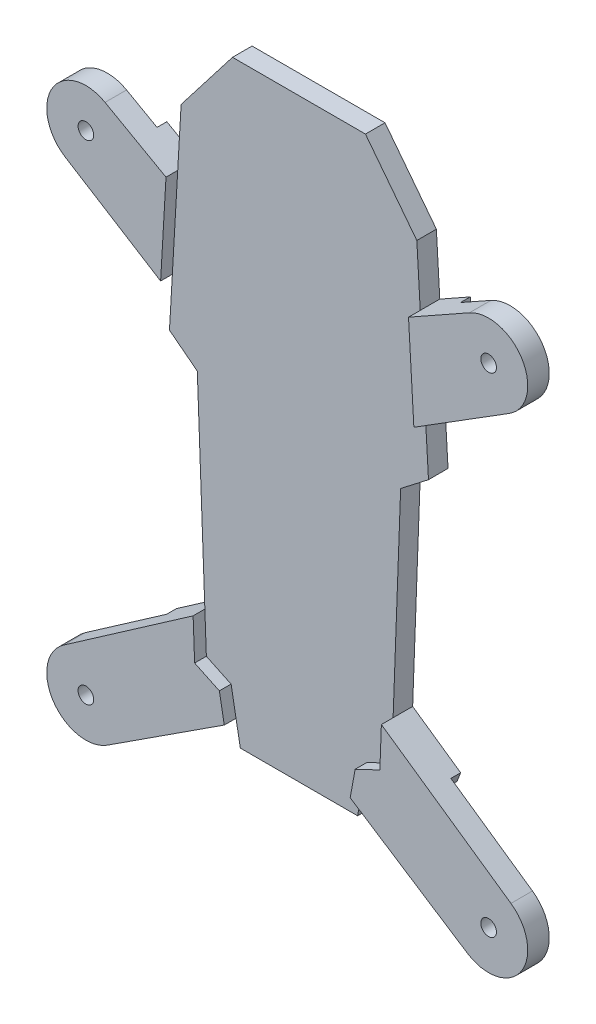
from build123d import *

# Parameters (mm, degrees)
EXTRUDE_1_DEPTH     = 5
SKETCH_2_R          = 10
SKETCH_2_R_2        = 2
EXTRUDE_2_DEPTH     = 8
SHELL_1_OUTLINE_R   = 4.5
SHELL_1_DEPTH       = 2.5
SHELL_START         = 2.5
SHELL_1_2_OUTLINE_R = 4.5
SHELL_1_2_DEPTH     = 3
CUT_EXTRUDE_6_DEPTH = 2.5


with BuildPart() as part:
    # ｽｹｯﾁ1 → ﾎﾞｽ - 押し出し1 (new body)
    with BuildSketch(Plane.XY):
        Polygon((-15, -77.5), (15, -77.5), (17.362836016, -64.5), (23.688654544, -61.502664525), (26, 0.497335475), (33.120827994, 6.001316642), (30.14, 57.5), (17, 74.5), (-17, 74.5), (-30.14, 57.5), (-33.120827994, 6.001316642), (-26, 0.497335475), (-23.688654544, -61.502664525), (-17.362836016, -64.5), align=None)
    extrude(amount=EXTRUDE_1_DEPTH)

    # ｽｹｯﾁ2 → ﾎﾞｽ - 押し出し2 (add)
    # profile 1 of 8: a face of its own
    with BuildSketch(Plane(origin=(0, 0, 0), x_dir=(-1, 0, 0), z_dir=(0, 0, -1))):
        with BuildLine():
            Line((-32.382872215, 18.750710787), (-31.011292455, 42.446996487))
            Line((-31.011292455, 42.446996487), (-46.596716305, 51.215377732))
            ThreePointArc((-46.596716305, 51.215377732), (-42.867710705, 47.548126536), (-41.5, 42.5))
            ThreePointArc((-41.5, 42.5), (-46.653423142, 33.752960915), (-56.802138552, 34.021360559))
            Line((-56.802138552, 34.021360559), (-32.382872215, 18.750710787))
        make_face()
    # profile 2 of 8: a face of its own
    with BuildSketch(Plane(origin=(0, 0, 0), x_dir=(-1, 0, 0), z_dir=(0, 0, -1))):
        with Locations((-51.5, 42.5)):
            Circle(SKETCH_2_R)
        with Locations((-51.5, 42.5)):
            Circle(SKETCH_2_R_2, mode=Mode.SUBTRACT)
    # profile 3 of 8: a face of its own
    with BuildSketch(Plane(origin=(0, 0, 0), x_dir=(-1, 0, 0), z_dir=(0, 0, -1))):
        with Locations((51.5, 42.5)):
            Circle(SKETCH_2_R)
        with Locations((51.5, 42.5)):
            Circle(SKETCH_2_R_2, mode=Mode.SUBTRACT)
    # profile 4 of 8: a face of its own
    with BuildSketch(Plane(origin=(0, 0, 0), x_dir=(-1, 0, 0), z_dir=(0, 0, -1))):
        with Locations((51.5, -82.5)):
            Circle(SKETCH_2_R)
        with Locations((51.5, -82.5)):
            Circle(SKETCH_2_R_2, mode=Mode.SUBTRACT)
    # profile 5 of 8: a face of its own
    with BuildSketch(Plane(origin=(0, 0, 0), x_dir=(-1, 0, 0), z_dir=(0, 0, -1))):
        with BuildLine():
            Line((16.09996425, -71.448147417), (46.056282089, -90.888440577))
            ThreePointArc((46.056282089, -90.888440577), (43.199925585, -76.922476831), (57.20989431, -74.290425896))
            Line((57.20989431, -74.290425896), (24.071173493, -51.241898524))
            Line((24.071173493, -51.241898524), (23.688654544, -61.502664525))
            Line((23.688654544, -61.502664525), (17.362836016, -64.5))
            Line((17.362836016, -64.5), (16.09996425, -71.448147417))
        make_face()
    # profile 6 of 8: a face of its own
    with BuildSketch(Plane(origin=(0, 0, 0), x_dir=(-1, 0, 0), z_dir=(0, 0, -1))):
        with BuildLine():
            ThreePointArc((56.802138552, 34.021360559), (42.900678635, 37.395916139), (46.596716305, 51.215377732))
            Line((46.596716305, 51.215377732), (31.011292455, 42.446996487))
            Line((31.011292455, 42.446996487), (32.382872215, 18.750710787))
            Line((32.382872215, 18.750710787), (56.802138552, 34.021360559))
        make_face()
    # profile 7 of 8: a face of its own
    with BuildSketch(Plane(origin=(0, 0, 0), x_dir=(-1, 0, 0), z_dir=(0, 0, -1))):
        with BuildLine():
            Line((-46.056282089, -90.888440577), (-16.09996425, -71.448147417))
            Line((-16.09996425, -71.448147417), (-17.362836016, -64.5))
            Line((-17.362836016, -64.5), (-23.688654544, -61.502664525))
            Line((-23.688654544, -61.502664525), (-24.071173493, -51.241898524))
            Line((-24.071173493, -51.241898524), (-57.20989431, -74.290425896))
            ThreePointArc((-57.20989431, -74.290425896), (-46.868528479, -73.637186025), (-41.5, -82.5))
            ThreePointArc((-41.5, -82.5), (-42.712589144, -87.272987581), (-46.056282089, -90.888440577))
        make_face()
    # profile 8 of 8: a face of its own
    with BuildSketch(Plane(origin=(0, 0, 0), x_dir=(-1, 0, 0), z_dir=(0, 0, -1))):
        with Locations((-51.5, -82.5)):
            Circle(SKETCH_2_R)
        with Locations((-51.5, -82.5)):
            Circle(SKETCH_2_R_2, mode=Mode.SUBTRACT)
    extrude(amount=-EXTRUDE_2_DEPTH)

    # ｼｪﾙ1: read off the stored shape, not the designer's step
    # ｼｪﾙ1 outline → ｼｪﾙ1 (cut)
    with BuildSketch(Plane.XY):
        with BuildLine():
            Line((21.522008123, -52.514136891), (23.545326343, 1.75976204))
            Line((23.545326343, 1.75976204), (30.548821684, 7.173051968))
            Line((30.548821684, 7.173051968), (29.801456877, 20.085002485))
            Line((29.801456877, 20.085002485), (55.476603914, 36.141020419))
            ThreePointArc((55.476603914, 36.141020419), (57.949491024, 46.328062896), (47.822537229, 49.036533299))
            Line((47.822537229, 49.036533299), (28.746880144, 38.304541956))
            Line((28.746880144, 38.304541956), (27.688881042, 56.583208435))
            Line((27.688881042, 56.583208435), (15.772608032, 72))
            Line((15.772608032, 72), (-15.772608032, 72))
            Line((-15.772608032, 72), (-27.688881042, 56.583208435))
            Line((-27.688881042, 56.583208435), (-28.746880144, 38.304541956))
            Line((-28.746880144, 38.304541956), (-47.822537229, 49.036533299))
            ThreePointArc((-47.822537229, 49.036533299), (-57.949491024, 46.328062896), (-55.476603914, 36.141020419))
            Line((-55.476603914, 36.141020419), (-29.801456877, 20.085002485))
            Line((-29.801456877, 20.085002485), (-30.548821684, 7.173051968))
            Line((-30.548821684, 7.173051968), (-23.545326343, 1.75976204))
            Line((-23.545326343, 1.75976204), (-21.522008123, -52.514136891))
            Line((-21.522008123, -52.514136891), (-55.782420733, -76.342819422))
            ThreePointArc((-55.782420733, -76.342819422), (-57.725055812, -86.683142377), (-47.417211567, -88.791330433))
            Line((-47.417211567, -88.791330433), (-14.311630395, -67.307308042))
            Line((-14.311630395, -67.307308042), (-12.913432732, -75))
            Line((-12.913432732, -75), (12.913432732, -75))
            Line((12.913432732, -75), (14.311630395, -67.307308042))
            Line((14.311630395, -67.307308042), (47.417211567, -88.791330433))
            ThreePointArc((47.417211567, -88.791330433), (57.725055812, -86.683142377), (55.782420733, -76.342819422))
            Line((55.782420733, -76.342819422), (21.522008123, -52.514136891))
        make_face()
        with Locations((51.5, -82.5)):
            Circle(SHELL_1_OUTLINE_R, mode=Mode.SUBTRACT)
        with Locations((-51.5, -82.5)):
            Circle(SHELL_1_OUTLINE_R, mode=Mode.SUBTRACT)
        with Locations((-51.5, 42.5)):
            Circle(SHELL_1_OUTLINE_R, mode=Mode.SUBTRACT)
        with Locations((51.5, 42.5)):
            Circle(SHELL_1_OUTLINE_R, mode=Mode.SUBTRACT)
    extrude(amount=SHELL_1_DEPTH, mode=Mode.SUBTRACT)

    # Shell 1 2 outline → Shell 1 2 (cut)
    # profile 1 of 4: a face of its own
    with BuildSketch(Plane.XY.offset(SHELL_START)):
        with BuildLine():
            Line((55.782420733, -76.342819422), (26.399026656, -55.906183789))
            Line((26.399026656, -55.906183789), (26.130390005, -63.112147889))
            Line((26.130390005, -63.112147889), (19.593043591, -66.209710715))
            Line((19.593043591, -66.209710715), (18.857369821, -70.257286993))
            Line((18.857369821, -70.257286993), (47.417211567, -88.791330433))
            ThreePointArc((47.417211567, -88.791330433), (57.725055812, -86.683142377), (55.782420733, -76.342819422))
        make_face()
        with Locations((51.5, -82.5)):
            Circle(SHELL_1_2_OUTLINE_R, mode=Mode.SUBTRACT)
    # profile 2 of 4: a face of its own
    with BuildSketch(Plane.XY.offset(SHELL_START)):
        with BuildLine():
            Line((33.597298428, 41.033394063), (34.634873185, 23.10759156))
            Line((34.634873185, 23.10759156), (55.476603914, 36.141020419))
            ThreePointArc((55.476603914, 36.141020419), (57.949491024, 46.328062896), (47.822537229, 49.036533299))
            Line((47.822537229, 49.036533299), (33.597298428, 41.033394063))
        make_face()
        with Locations((51.5, 42.5)):
            Circle(SHELL_1_2_OUTLINE_R, mode=Mode.SUBTRACT)
    # profile 3 of 4: a face of its own
    with BuildSketch(Plane.XY.offset(SHELL_START)):
        with BuildLine():
            Line((-47.417211567, -88.791330433), (-18.857369821, -70.257286993))
            Line((-18.857369821, -70.257286993), (-19.593043591, -66.209710715))
            Line((-19.593043591, -66.209710715), (-26.130390005, -63.112147889))
            Line((-26.130390005, -63.112147889), (-26.399026656, -55.90618379))
            Line((-26.399026656, -55.90618379), (-55.782420733, -76.342819422))
            ThreePointArc((-55.782420733, -76.342819422), (-57.725055812, -86.683142377), (-47.417211567, -88.791330433))
        make_face()
        with Locations((-51.5, -82.5)):
            Circle(SHELL_1_2_OUTLINE_R, mode=Mode.SUBTRACT)
    # profile 4 of 4: a face of its own
    with BuildSketch(Plane.XY.offset(SHELL_START)):
        with BuildLine():
            Line((-34.634873185, 23.10759156), (-33.597298428, 41.033394063))
            Line((-33.597298428, 41.033394063), (-47.822537229, 49.036533299))
            ThreePointArc((-47.822537229, 49.036533299), (-57.949491024, 46.328062896), (-55.476603914, 36.141020419))
            Line((-55.476603914, 36.141020419), (-34.634873185, 23.10759156))
        make_face()
        with Locations((-51.5, 42.5)):
            Circle(SHELL_1_2_OUTLINE_R, mode=Mode.SUBTRACT)
    extrude(amount=SHELL_1_2_DEPTH, mode=Mode.SUBTRACT)

    # ｽｹｯﾁ5 → ｶｯﾄ - 押し出し6 (cut)
    with BuildSketch(Plane(origin=(0, 0, 0), x_dir=(-1, 0, 0), z_dir=(0, 0, -1))):
        Polygon((-38.80400438, 46.831187109), (-38.80400438, 43.962694111), (-39.472839378, 23.184439628), (-51.319731768, 2.127093459), (-84.265468017, 28.099065241), (-81.185505749, 33.573566869), (-64.091586556, 65.569805047), (-41.966326194, 51.733717696), align=None)
        Polygon((-39.472839378, -51.723167443), (-24.731165472, -89.760648138), (-36.427967097, -116.261009638), (-70.745334213, -107.593739558), (-74.01113331, -73.736521524), align=None)
        Polygon((70.745334213, -107.593739558), (74.01113331, -73.736521524), (39.472839378, -51.723167443), (24.731165472, -89.760648138), (36.427967097, -116.261009638), align=None)
        Polygon((64.091586556, 65.569805047), (41.966326194, 51.733717696), (38.80400438, 46.831187109), (38.80400438, 43.962694111), (39.472839378, 23.184439628), (51.319731768, 2.127093459), (84.265468017, 28.099065241), (81.185505749, 33.573566869), align=None)
    extrude(amount=-CUT_EXTRUDE_6_DEPTH, mode=Mode.SUBTRACT)


solid = part.part
